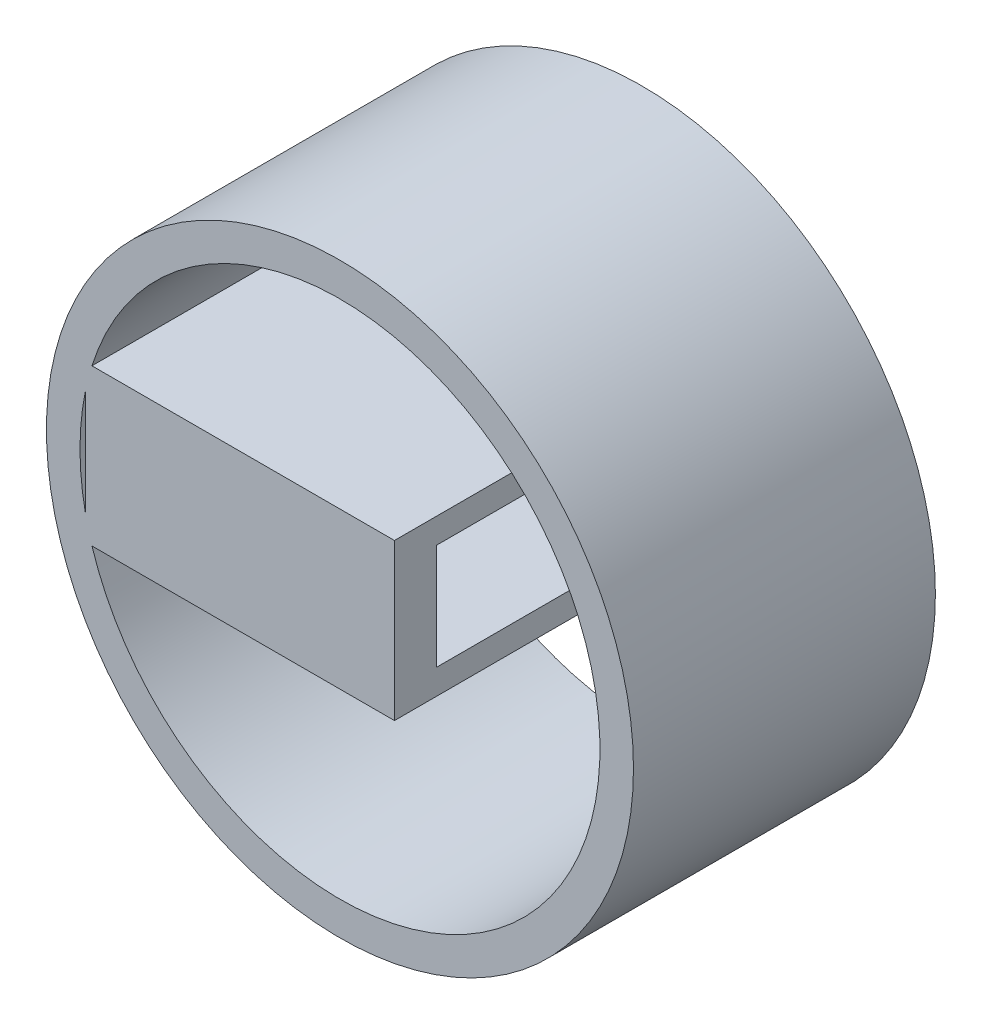
from build123d import *

# Parameters (mm, degrees)
SKETCH1_R           = 35
SKETCH1_R_2         = 31
BOSS_EXTRUDE1_DEPTH = 36
BOSS_EXTRUDE3_START = -27
BOSS_EXTRUDE3_DEPTH = 27
SKETCH7_W           = 13.353088805
SKETCH7_H           = 12.6
BOSS_EXTRUDE4_DEPTH = 20
SKETCH8_W           = 17
SKETCH8_H           = 12.6
BOSS_EXTRUDE5_DEPTH = 5
BOSS_EXTRUDE6_DEPTH = 6.5
BOSS_EXTRUDE2_START = -35
BOSS_EXTRUDE2_DEPTH = 35


# Read off the part's stored shape, not the designer's step: Boss-Extrude6
with BuildPart() as part:
    # Sketch1 → Boss-Extrude1 (new body)
    with BuildSketch(Plane.XY):
        Circle(SKETCH1_R)
        Circle(SKETCH1_R_2, mode=Mode.SUBTRACT)
    extrude(amount=BOSS_EXTRUDE1_DEPTH)

    # Sketch5 → Boss-Extrude3 (add)
    with BuildSketch(Plane.XY.offset(36).offset(BOSS_EXTRUDE3_START)):
        with BuildLine():
            Line((0, 6.3), (0, 9.3))
            Line((0, 9.3), (-29.572115244, 9.3))
            ThreePointArc((-29.572115244, 9.3), (-30.000125334, 7.809768238), (-30.353088805, 6.3))
            Line((-30.353088805, 6.3), (0, 6.3))
        make_face()
        with BuildLine():
            ThreePointArc((-30.353088805, -6.3), (-30.000125334, -7.809768238), (-29.572115244, -9.3))
            Line((-29.572115244, -9.3), (0, -9.3))
            Line((0, -9.3), (0, -6.3))
            Line((0, -6.3), (-30.353088805, -6.3))
        make_face()
    extrude(amount=BOSS_EXTRUDE3_DEPTH)

    # Sketch7 → Boss-Extrude4 (add)
    with BuildSketch(Plane.XY.offset(36)):
        with Locations((-23.676544402, 0)):
            Rectangle(SKETCH7_W, SKETCH7_H)
    extrude(amount=-BOSS_EXTRUDE4_DEPTH)

    # Sketch8 → Boss-Extrude5 (add)
    with BuildSketch(Plane.XY.offset(36)):
        with Locations((-8.5, 0)):
            Rectangle(SKETCH8_W, SKETCH8_H)
    extrude(amount=-BOSS_EXTRUDE5_DEPTH)

    # Boss-Extrude6 outline → Boss-Extrude6 (add)
    with BuildSketch(Plane(origin=(0, 0, 0), x_dir=(0, 0, -1), z_dir=(1, 0, 0))):
        Polygon((-31, 6.3), (-9, 6.3), (-9, 9.3), (-36, 9.3), (-36, -9.3), (-9, -9.3), (-9, -6.3), (-31, -6.3), align=None)
    extrude(amount=BOSS_EXTRUDE6_DEPTH)

    # Sketch2 → Boss-Extrude2 (add)
    with BuildSketch(Plane.XY.offset(36).offset(BOSS_EXTRUDE2_START)):
        with BuildLine():
            Line((0, -6.3), (-30.353088805, -6.3))
            ThreePointArc((-30.353088805, -6.3), (-30.000125334, -7.809768238), (-29.572115244, -9.3))
            Line((-29.572115244, -9.3), (0, -9.3))
            Line((0, -9.3), (0, -6.3))
        make_face()
        with BuildLine():
            Line((-30.353088805, 6.3), (0, 6.3))
            Line((0, 6.3), (0, 9.3))
            Line((0, 9.3), (-29.572115244, 9.3))
            ThreePointArc((-29.572115244, 9.3), (-30.000125334, 7.809768238), (-30.353088805, 6.3))
        make_face()
    extrude(amount=BOSS_EXTRUDE2_DEPTH)


solid = part.part
